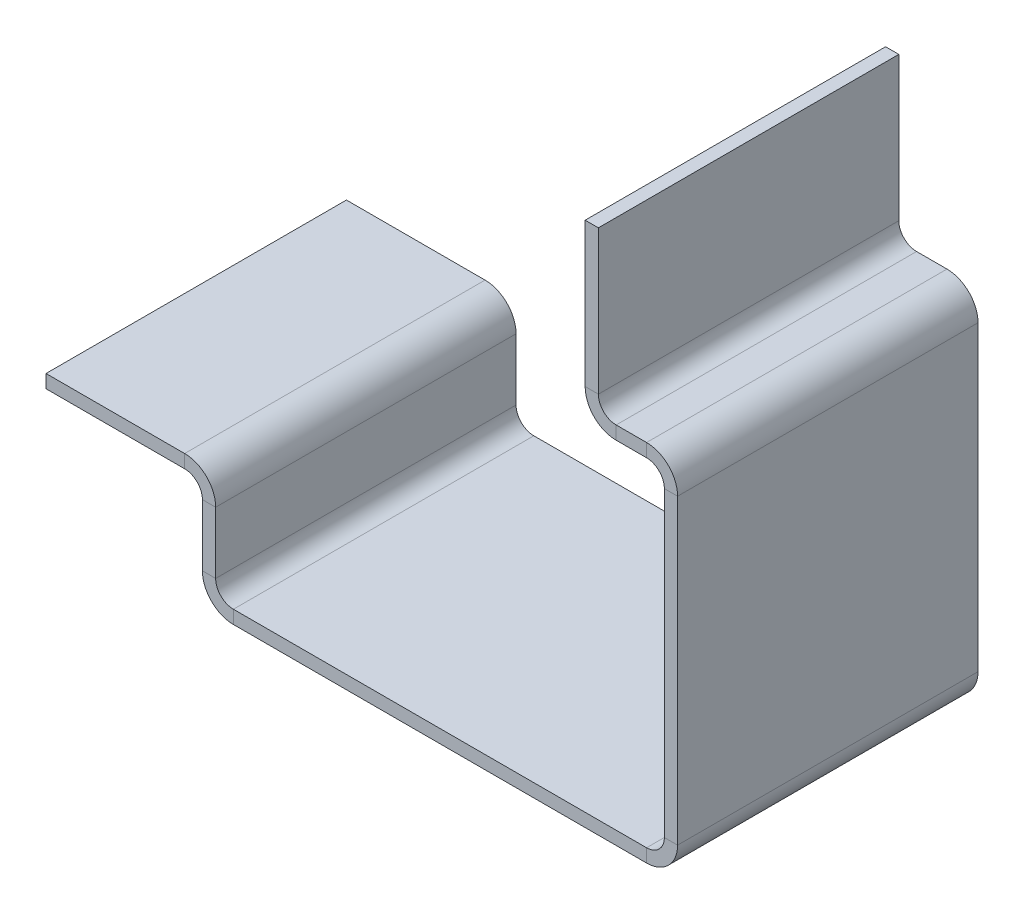
from build123d import *

# Parameters (mm, degrees)
BRIDA_BASE1_DEPTH = 144.15


# Sheet-metal steps are written as plain solids
with BuildPart() as part:
    # Croquis1 → Brida base1 (new body)
    with BuildSketch(Plane.XY):
        with BuildLine():
            Line((258.7, 246.05), (258.7, 176.93))
            ThreePointArc((258.7, 176.93), (263.058251096, 166.408251096), (273.58, 162.05))
            Line((273.58, 162.05), (288.17, 162.05))
            ThreePointArc((288.17, 162.05), (294.201620844, 159.551620844), (296.7, 153.52))
            Line((296.7, 153.52), (296.7, 8.53))
            ThreePointArc((296.7, 8.53), (294.201620844, 2.498379156), (288.17, 0))
            Line((288.17, 0), (89.93, 0))
            ThreePointArc((89.93, 0), (83.898379156, 2.498379156), (81.4, 8.53))
            Line((81.4, 8.53), (81.4, 38.12))
            ThreePointArc((81.4, 38.12), (77.041748904, 48.641748904), (66.52, 53))
            Line((66.52, 53), (0, 53))
            Line((0, 53), (0, 46.65))
            Line((0, 46.65), (66.52, 46.65))
            ThreePointArc((66.52, 46.65), (72.551620844, 44.151620844), (75.05, 38.12))
            Line((75.05, 38.12), (75.05, 8.53))
            ThreePointArc((75.05, 8.53), (79.408251096, -1.991748904), (89.93, -6.35))
            Line((89.93, -6.35), (288.17, -6.35))
            ThreePointArc((288.17, -6.35), (298.691748904, -1.991748904), (303.05, 8.53))
            Line((303.05, 8.53), (303.05, 153.52))
            ThreePointArc((303.05, 153.52), (298.691748904, 164.041748904), (288.17, 168.4))
            Line((288.17, 168.4), (273.58, 168.4))
            ThreePointArc((273.58, 168.4), (267.548379156, 170.898379156), (265.05, 176.93))
            Line((265.05, 176.93), (265.05, 246.05))
            Line((265.05, 246.05), (258.7, 246.05))
        make_face()
    extrude(amount=BRIDA_BASE1_DEPTH)


solid = part.part
